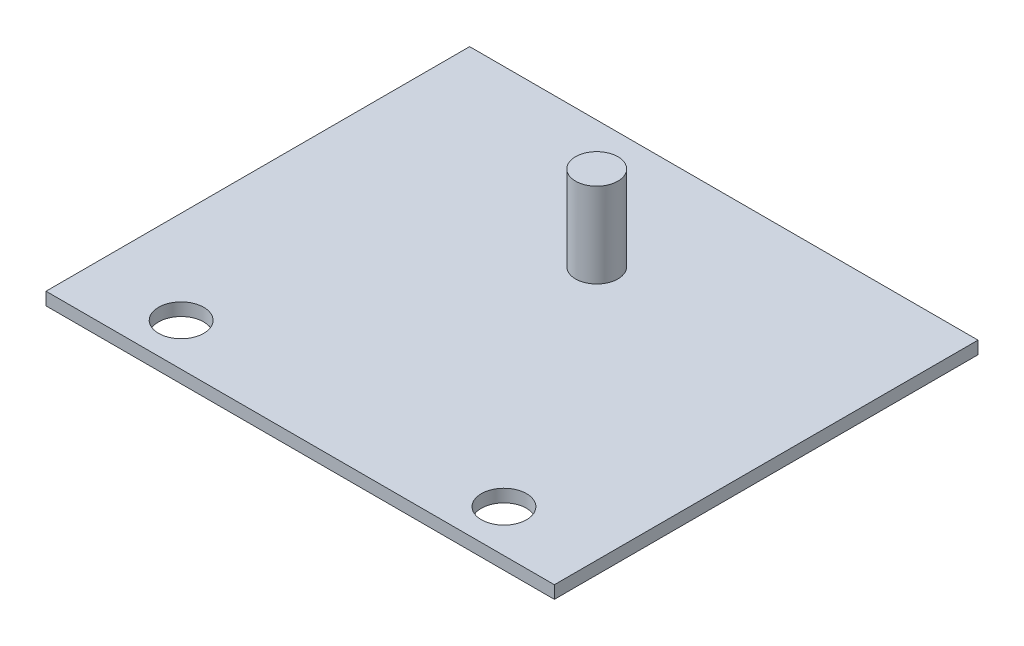
from build123d import *

# Parameters (mm, degrees)
SKETCH1_W           = 120
SKETCH1_H           = 100
BOSS_EXTRUDE1_DEPTH = 3
SKETCH2_R           = 5.334
CUT_EXTRUDE1_DEPTH  = 157.23379916
SKETCH3_R           = 5
BOSS_EXTRUDE2_DEPTH = 20


with BuildPart() as part:
    # Sketch1 → Boss-Extrude1 (new body)
    with BuildSketch(Plane(origin=(0, 0, 0), x_dir=(1, 0, 0), z_dir=(0, 1, 0))):
        with Locations((60, 50)):
            Rectangle(SKETCH1_W, SKETCH1_H)
    extrude(amount=BOSS_EXTRUDE1_DEPTH)

    # Sketch2 → Cut-Extrude1 (cut, through all)
    with BuildSketch(Plane(origin=(0, 3, 0), x_dir=(1, 0, 0), z_dir=(0, 1, 0))):
        with Locations((21.9, 10)):
            Circle(SKETCH2_R)
        with Locations((98.1, 10)):
            Circle(SKETCH2_R)
    extrude(amount=-CUT_EXTRUDE1_DEPTH, mode=Mode.SUBTRACT)

    # Sketch3 → Boss-Extrude2 (add)
    with BuildSketch(Plane(origin=(0, 3, 0), x_dir=(1, 0, 0), z_dir=(0, 1, 0))):
        with Locations((60, 70)):
            Circle(SKETCH3_R)
    extrude(amount=BOSS_EXTRUDE2_DEPTH)


solid = part.part
